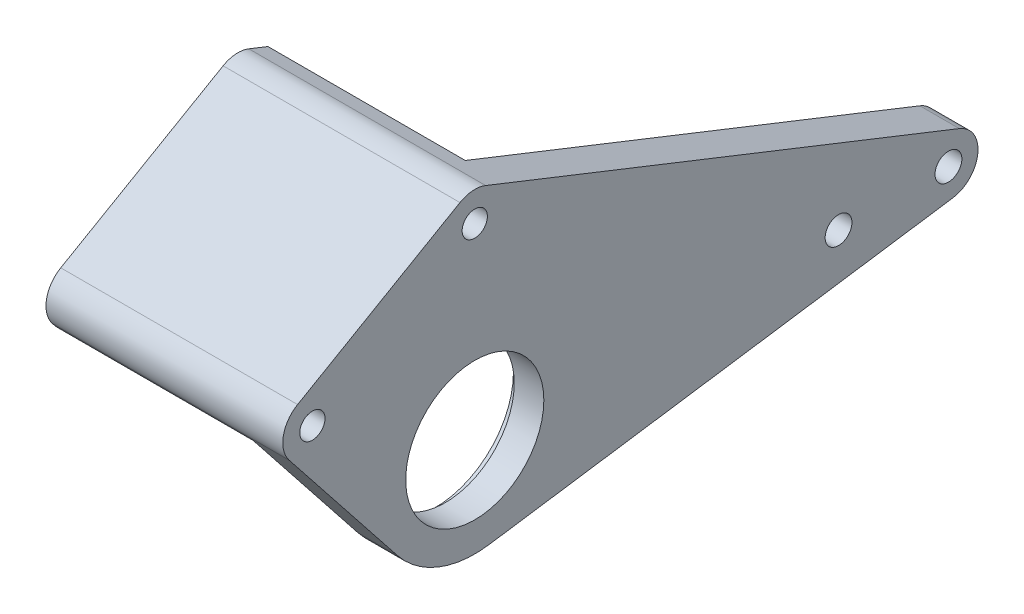
from build123d import *

# Parameters (mm, degrees)
SKETCH1_R           = 2.159
SKETCH1_R_2         = 11.112499999999992
SKETCH1_R_3         = 2.032000000000007
SKETCH1_R_4         = 2.0320000000000227
SKETCH1_R_5         = 2.159000000000001
BOSS_EXTRUDE1_DEPTH = 6.35
SKETCH2_R           = 12.573000000000004
CUT_EXTRUDE1_DEPTH  = 1.5875
BOSS_EXTRUDE2_DEPTH = 31.75
FILLET1_R           = 3.175


with BuildPart() as part:
    # Sketch1 → Boss-Extrude1 (new body)
    with BuildSketch(Plane(origin=(0, 0, 0), x_dir=(0, 0, -1), z_dir=(1, 0, 0))):
        with BuildLine():
            Line((1.7528307479226393, 4.428203994751931), (-74.44716925207737, 34.59070399475192))
            ThreePointArc((-74.44716925207737, 34.59070399475192), (-76.54899129091997, 34.912195919620736), (-78.58125, 34.28694598552338))
            Line((-78.58125, 34.28694598552338), (-104.70274124164806, 19.205695985523498))
            ThreePointArc((-104.70274124164806, 19.205695985523498), (-106.99949191381467, 15.974399461853373), (-106.05477455872966, 12.124224142081344))
            Line((-106.05477455872966, 12.124224142081344), (-88.64427772360533, -9.856752859729227))
            ThreePointArc((-88.64427772360533, -9.856752859729227), (-82.04819337667968, -14.758531743671528), (-73.88489583333335, -15.705283114209777))
            Line((-73.88489583333335, -15.705283114209777), (0.6945312500000005, -4.711584934262932))
            ThreePointArc((0.6945312500000005, -4.711584934262932), (4.730891100411702, -0.5477916082283132), (1.7528307479226393, 4.428203994751931))
        make_face()
        Circle(SKETCH1_R, mode=Mode.SUBTRACT)
        with Locations((-76.2, -9.33e-15)):
            Circle(SKETCH1_R_2, mode=Mode.SUBTRACT)
        with Locations((-76.2, 30.162499999999987)):
            Circle(SKETCH1_R_3, mode=Mode.SUBTRACT)
        with Locations((-102.32149124164806, 15.081250000000113)):
            Circle(SKETCH1_R_4, mode=Mode.SUBTRACT)
        with Locations((-17.677, -2.16e-15)):
            Circle(SKETCH1_R_5, mode=Mode.SUBTRACT)
    extrude(amount=BOSS_EXTRUDE1_DEPTH)

    # Sketch2 → Cut-Extrude1 (cut)
    with BuildSketch(Plane(origin=(6.35, 0, 0), x_dir=(0, 0, -1), z_dir=(1, 0, 0))):
        with Locations((-76.2, -9.33e-15)):
            Circle(SKETCH2_R)
    extrude(amount=-CUT_EXTRUDE1_DEPTH, mode=Mode.SUBTRACT)

    # Sketch3 → Boss-Extrude2 (add)
    with BuildSketch(Plane(origin=(6.35, 0, 0), x_dir=(0, 0, -1), z_dir=(1, 0, 0))):
        with BuildLine():
            Line((-71.374, 33.37424116580463), (-74.44716925207737, 34.59070399475192))
            ThreePointArc((-74.44716925207737, 34.59070399475192), (-76.54899129091999, 34.912195919620736), (-78.58125000000001, 34.286945985523374))
            Line((-78.58125000000001, 34.286945985523374), (-104.70274124164803, 19.20569598552344))
            ThreePointArc((-104.70274124164803, 19.20569598552344), (-106.9994919138146, 15.974399461853341), (-106.05477455872966, 12.124224142081346))
            Line((-106.05477455872966, 12.124224142081344), (-102.19507254945981, 7.251300531513006))
            ThreePointArc((-102.19507254945981, 7.251300531513006), (-101.25999910991413, 10.016067135413087), (-100.03183060675102, 12.663688490369834))
            Line((-100.03183060675087, 12.663688490369697), (-102.32149124164805, 11.341752306458922))
            Line((-102.32149124164805, 11.341752306458922), (-105.55999124164805, 13.211501153229527))
            Line((-105.55999124164805, 13.211501153229527), (-105.55999124164805, 16.950998846770727))
            Line((-105.55999124164805, 16.950998846770727), (-102.32149124164808, 18.820747693541325))
            Line((-102.32149124164808, 18.820747693541325), (-99.08299124164807, 16.95099884677072))
            Line((-99.08299124164807, 16.95099884677072), (-99.08299124164807, 14.307126478949076))
            ThreePointArc((-99.08299124164829, 14.307126478949137), (-89.6937500000007, 23.371860584632124), (-77.14883936510445, 26.970814969318738))
            Line((-77.14883936510427, 26.97081496931942), (-79.4385, 28.292751153229368))
            Line((-79.4385, 28.292751153229368), (-79.4385, 32.03224884677059))
            Line((-79.4385, 32.03224884677059), (-76.19999999999999, 33.901997693541205))
            Line((-76.19999999999999, 33.901997693541205), (-72.9615, 32.03224884677061))
            Line((-72.9615, 32.03224884677061), (-72.9615, 28.292751153229386))
            Line((-72.9615, 28.292751153229386), (-75.25116063489577, 26.97081496931942))
            ThreePointArc((-75.25116063489558, 26.970814969318738), (-73.30501454969252, 26.8317762269386), (-71.374, 26.552492919686465))
            Line((-71.374, 26.552492919686458), (-71.374, 33.37424116580463))
        make_face()
    extrude(amount=BOSS_EXTRUDE2_DEPTH)

    # Fillet1
    fillet1_edges = [part.edges().sort_by_distance(p)[0] for p in [
        (22.225, 26.55249291968646, 71.374),
        (22.225, 7.251300531513006, 102.19507254945981),
    ]]
    fillet(fillet1_edges, radius=FILLET1_R)


with BuildPart() as body_2:
    # Mirror1: mirrored copy
    add(part.part.mirror(Plane(origin=(6.35, 0, 0), x_dir=(0, 0, 1), z_dir=(1, 0, 0))))


solid = body_2.part
